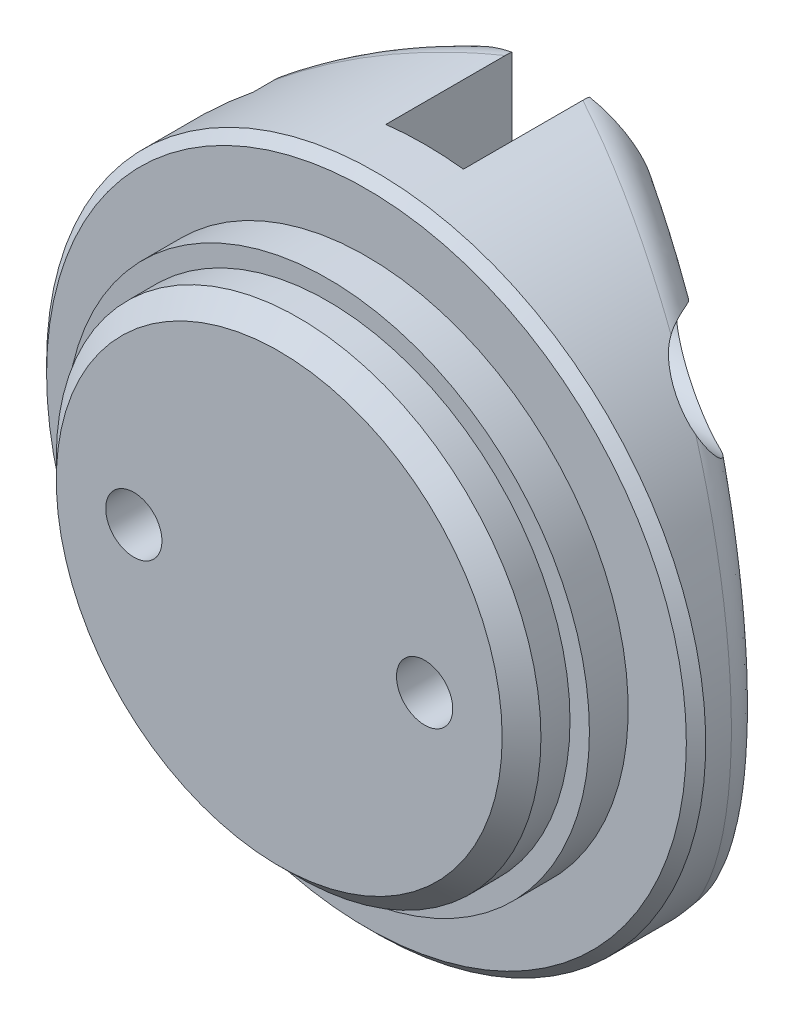
from build123d import *
from build123d.topology import SkipClean

# Parameters (mm, degrees)
SKETCH1_R               = 12.5
BOSS_EXTRUDE1_DEPTH     = 4.5
SKETCH2_R               = 17
BOSS_EXTRUDE2_DEPTH     = 3
CHAMFER1_SIZE           = 1
BOSS_EXTRUDE3_DEPTH     = 20
CUT_EXTRUDE1_DEPTH      = 28.915049704
CUT_EXTRUDE1_DEPTH_BACK = 28.915049704
SKETCH4_R               = 1.25
SKETCH5_R               = 13.5
BOSS_EXTRUDE4_DEPTH     = 2
CUT_EXTRUDE2_DEPTH      = 30.748949561
CUT_EXTRUDE2_DEPTH_BACK = 30.748949561
SKETCH6_W               = 46.724377104
SKETCH6_H               = 45.890013228
SKETCH6_R               = 17
SKETCH7_W               = 4
SKETCH7_H               = 14
CUT_EXTRUDE3_DEPTH      = 3
CUT_EXTRUDE4_START      = 6
SKETCH8_R               = 2.25
CUT_EXTRUDE4_DEPTH      = 33
CUT_EXTRUDE5_START      = -5
CUT_EXTRUDE5_DEPTH      = 33
FILLET1_R               = 2
CHAMFER2_SIZE           = 0.5
CUT_EXTRUDE6_START      = -6
SKETCH10_R              = 28
CUT_EXTRUDE6_DEPTH      = 10
SKETCH11_R              = 1.45
CUT_EXTRUDE7_DEPTH      = 10
FILLET2_R               = 1.4


with BuildPart() as part:
    # Sketch1 → Boss-Extrude1 (new body)
    with BuildSketch(Plane.XY):
        Circle(SKETCH1_R)
    extrude(amount=BOSS_EXTRUDE1_DEPTH)

    # Sketch2 → Boss-Extrude2 (add)
    with BuildSketch(Plane(origin=(0, 0, 0), x_dir=(-1, 0, 0), z_dir=(0, 0, -1))):
        Circle(SKETCH2_R)
    extrude(amount=BOSS_EXTRUDE2_DEPTH)

    # Chamfer1
    chamfer1_edges = [part.edges().sort_by_distance(p)[0] for p in [
        (-12.5, 0, 4.5),
    ]]
    chamfer(chamfer1_edges, length=CHAMFER1_SIZE)

    # Sketch3 → Boss-Extrude3 (add, symmetric)
    with BuildSketch(Plane(origin=(0, 0, 0), x_dir=(1, 0, 0), z_dir=(0, 1, 0))):
        Polygon((-17, 3), (-5.273971877, 9.5), (-2, 9.5), (-2, 3), align=None)
        Polygon((17, 3), (2, 3), (2, 9.5), (5.273971877, 9.5), align=None)
    extrude(amount=BOSS_EXTRUDE3_DEPTH, both=True)

    # Sketch4 → Cut-Extrude1 (cut, two sides: drawn at the far end of the back side and taken through both)
    with BuildSketch(Plane(origin=(0, 0, 0), x_dir=(0, 0, -1), z_dir=(1, 0, 0)).offset(-CUT_EXTRUDE1_DEPTH_BACK)):
        with Locations((5.75, 11)):
            Circle(SKETCH4_R)
        with Locations((5.75, -11)):
            Circle(SKETCH4_R)
    extrude(amount=CUT_EXTRUDE1_DEPTH + CUT_EXTRUDE1_DEPTH_BACK, mode=Mode.SUBTRACT)

    # Sketch5 → Boss-Extrude4 (add)
    with BuildSketch(Plane.XY):
        Circle(SKETCH5_R)
    extrude(amount=BOSS_EXTRUDE4_DEPTH)

    # Sketch6 → Cut-Extrude2 (cut, two sides: drawn at the far end of the back side and taken through both)
    with SkipClean():  # the faces are left unmerged after this step: merging them gives an invalid solid
        with BuildSketch(Plane.XY.offset(4.5).offset(-CUT_EXTRUDE2_DEPTH_BACK)):
            Rectangle(SKETCH6_W, SKETCH6_H)
            Circle(SKETCH6_R, mode=Mode.SUBTRACT)
        extrude(amount=CUT_EXTRUDE2_DEPTH + CUT_EXTRUDE2_DEPTH_BACK, mode=Mode.SUBTRACT)

    # Sketch7 → Cut-Extrude3 (cut)
    with SkipClean():  # the faces are left unmerged after this step: merging them gives an invalid solid
        with BuildSketch(Plane(origin=(0, 0, -3), x_dir=(-1, 0, 0), z_dir=(0, 0, -1))):
            Rectangle(SKETCH7_W, SKETCH7_H)
        extrude(amount=-CUT_EXTRUDE3_DEPTH, mode=Mode.SUBTRACT)

    # Sketch8 → Cut-Extrude4 (cut)
    with SkipClean():  # the faces are left unmerged after this step: merging them gives an invalid solid
        with BuildSketch(Plane(origin=(0, 0, 0), x_dir=(0, 0, -1), z_dir=(1, 0, 0)).offset(CUT_EXTRUDE4_START)):
            with Locations((5.75, 11)):
                Circle(SKETCH8_R)
            with Locations((5.75, -11)):
                Circle(SKETCH8_R)
        extrude(amount=CUT_EXTRUDE4_DEPTH, mode=Mode.SUBTRACT)

    # Sketch9 → Cut-Extrude5 (cut)
    with BuildSketch(Plane(origin=(0, 0, 0), x_dir=(0, 0, -1), z_dir=(1, 0, 0)).offset(CUT_EXTRUDE5_START)):
        Polygon((7.33771324, 8.25), (8.925426481, 11), (7.33771324, 13.75), (4.16228676, 13.75), (2.574573519, 11), (4.16228676, 8.25), align=None)
        Polygon((4.16228676, -13.75), (7.33771324, -13.75), (8.925426481, -11), (7.33771324, -8.25), (4.16228676, -8.25), (2.574573519, -11), align=None)
    extrude(amount=-CUT_EXTRUDE5_DEPTH, mode=Mode.SUBTRACT)

    # Fillet1
    fillet1_edges = [part.edges().sort_by_distance(p)[0] for p in [
        (8.144091596, 14.922257607, -7.909028362),
        (16.304229234, 4.813741692, -3.385681318),
        (8.144091596, -14.922257607, -7.909028362),
        (-7.711571864, -15.150302287, -8.148783736),
        (-7.711571864, 15.150302287, -8.148783736),
        (-16.447536722, -4.298666744, -3.306242768),
    ]]
    fillet(fillet1_edges, radius=FILLET1_R)

    # Chamfer2
    chamfer2_edges = [part.edges().sort_by_distance(p)[0] for p in [
        (17, 0, 0),
    ]]
    chamfer(chamfer2_edges, length=CHAMFER2_SIZE)

    # Sketch10 → Cut-Extrude6 (cut)
    with BuildSketch(Plane(origin=(0, 0, 0), x_dir=(0, 0, -1), z_dir=(1, 0, 0)).offset(CUT_EXTRUDE6_START)):
        with Locations((35, 0)):
            Circle(SKETCH10_R)
    extrude(amount=-CUT_EXTRUDE6_DEPTH, mode=Mode.SUBTRACT)

    # Sketch11 → Cut-Extrude7 (cut)
    with BuildSketch(Plane.XY.offset(4.5)):
        with Locations((-7.5, 0)):
            Circle(SKETCH11_R)
        with Locations((7.5, 0)):
            Circle(SKETCH11_R)
    extrude(amount=-CUT_EXTRUDE7_DEPTH, mode=Mode.SUBTRACT)

    # Fillet2
    fillet2_edges = [part.edges().sort_by_distance(p)[0] for p in [
        (-8.95, 0, -5.5),
        (6.05, 0, -5.5),
    ]]
    fillet(fillet2_edges, radius=FILLET2_R)


solid = part.part
